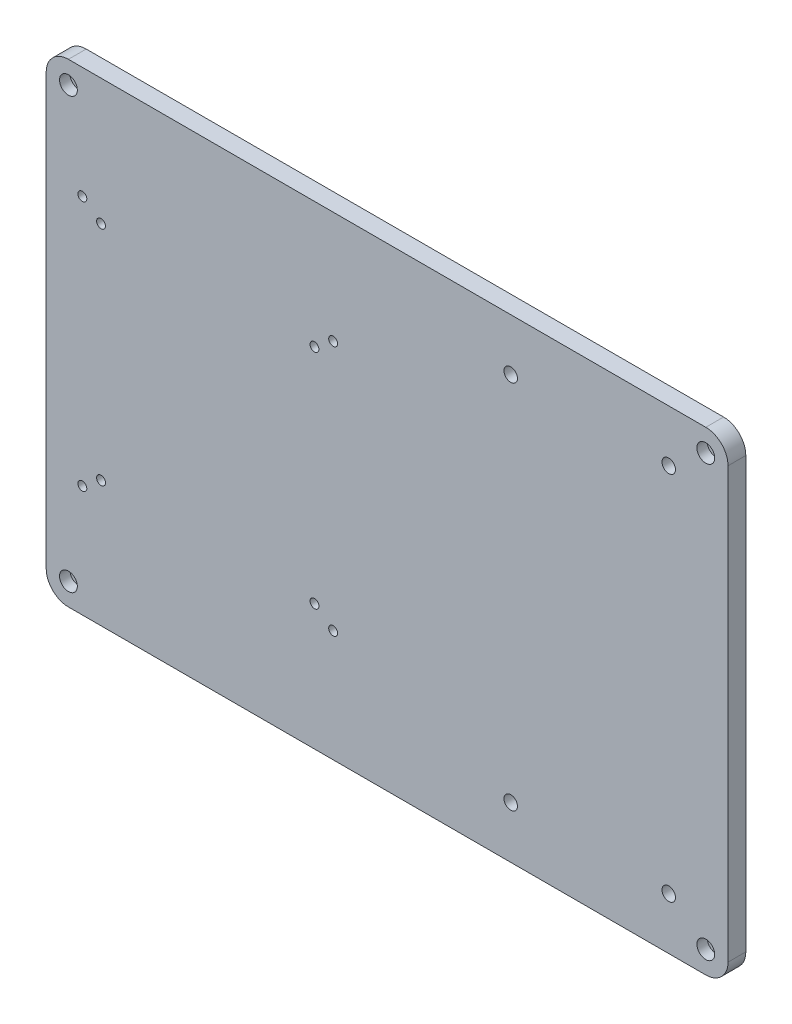
from build123d import *

# Parameters (mm, degrees)
BOSS_EXTRUDE1_DEPTH     = 6
SKETCH2_R               = 1.75
CUT_EXTRUDE1_DEPTH      = 10
SKETCH3_R               = 3
CUT_EXTRUDE2_DEPTH      = 3.5
SKETCH4_R               = 1.5
CUT_EXTRUDE3_DEPTH      = 141.2176879
CUT_EXTRUDE4_DEPTH      = 141.2176879
CUT_EXTRUDE4_DEPTH_BACK = 141.2176879
SKETCH5_R               = 2.273431662
SKETCH7_R               = 1.5
CUT_EXTRUDE6_DEPTH      = 141.2176879
SKETCH8_R               = 3
CUT_EXTRUDE7_DEPTH      = 3.5


with BuildPart() as part:
    # Sketch1 → Boss-Extrude1 (new body)
    with BuildSketch(Plane.XY):
        with BuildLine():
            Line((-107.5, 80), (107.5, 80))
            ThreePointArc((107.5, 80), (112.803300859, 77.803300859), (115, 72.5))
            Line((115, 72.5), (115, -72.5))
            ThreePointArc((115, -72.5), (112.803300859, -77.803300859), (107.5, -80))
            Line((107.5, -80), (-107.5, -80))
            ThreePointArc((-107.5, -80), (-112.803300859, -77.803300859), (-115, -72.5))
            Line((-115, -72.5), (-115, 72.5))
            ThreePointArc((-115, 72.5), (-112.803300859, 77.803300859), (-107.5, 80))
        make_face()
    extrude(amount=BOSS_EXTRUDE1_DEPTH)

    # Sketch2 → Cut-Extrude1 (cut)
    with BuildSketch(Plane.XY.offset(6)):
        with Locations((-107.5, -72.5)):
            Circle(SKETCH2_R)
        with Locations((-107.5, 72.5)):
            Circle(SKETCH2_R)
        with Locations((107.5, -72.5)):
            Circle(SKETCH2_R)
        with Locations((107.5, 72.5)):
            Circle(SKETCH2_R)
    extrude(amount=-CUT_EXTRUDE1_DEPTH, mode=Mode.SUBTRACT)

    # Sketch3 → Cut-Extrude2 (cut)
    with BuildSketch(Plane.XY.offset(6)):
        with Locations((-107.5, -72.5)):
            Circle(SKETCH3_R)
        with Locations((-107.5, 72.5)):
            Circle(SKETCH3_R)
        with Locations((107.5, 72.5)):
            Circle(SKETCH3_R)
        with Locations((107.5, -72.5)):
            Circle(SKETCH3_R)
    extrude(amount=-CUT_EXTRUDE2_DEPTH, mode=Mode.SUBTRACT)

    # Sketch4 → Cut-Extrude3 (cut, through all)
    with BuildSketch(Plane.XY.offset(6)):
        with Locations((-96.5, 37.5)):
            Circle(SKETCH4_R)
        with Locations((-96.5, -37.5)):
            Circle(SKETCH4_R)
        with Locations((-24.5, 37.5)):
            Circle(SKETCH4_R)
        with Locations((-24.5, -37.5)):
            Circle(SKETCH4_R)
    extrude(amount=-CUT_EXTRUDE3_DEPTH, mode=Mode.SUBTRACT)

    # Sketch5 → Cut-Extrude4 (cut, two sides: drawn at the far end of the back side and taken through both)
    with BuildSketch(Plane.XY.offset(6).offset(-CUT_EXTRUDE4_DEPTH_BACK)):
        with Locations((95, -62.5)):
            Circle(SKETCH5_R)
        with Locations((95, 62.5)):
            Circle(SKETCH5_R)
        with Locations((41.7, -62.5)):
            Circle(SKETCH5_R)
        with Locations((41.7, 62.5)):
            Circle(SKETCH5_R)
    extrude(amount=CUT_EXTRUDE4_DEPTH + CUT_EXTRUDE4_DEPTH_BACK, mode=Mode.SUBTRACT)

    # Sketch7 → Cut-Extrude6 (cut, through all)
    with BuildSketch(Plane.XY.offset(6)):
        with Locations((-102.8, 42.3)):
            Circle(SKETCH7_R)
        with Locations((-102.8, -42.3)):
            Circle(SKETCH7_R)
        with Locations((-18.2, -42.3)):
            Circle(SKETCH7_R)
        with Locations((-18.2, 42.3)):
            Circle(SKETCH7_R)
    extrude(amount=-CUT_EXTRUDE6_DEPTH, mode=Mode.SUBTRACT)

    # Sketch8 → Cut-Extrude7 (cut)
    with BuildSketch(Plane(origin=(0, 0, 0), x_dir=(-1, 0, 0), z_dir=(0, 0, -1))):
        with Locations((18.2, 42.3)):
            Circle(SKETCH8_R)
        with Locations((18.2, -42.3)):
            Circle(SKETCH8_R)
        with Locations((102.8, -42.3)):
            Circle(SKETCH8_R)
        with Locations((102.8, 42.3)):
            Circle(SKETCH8_R)
    extrude(amount=-CUT_EXTRUDE7_DEPTH, mode=Mode.SUBTRACT)


solid = part.part
